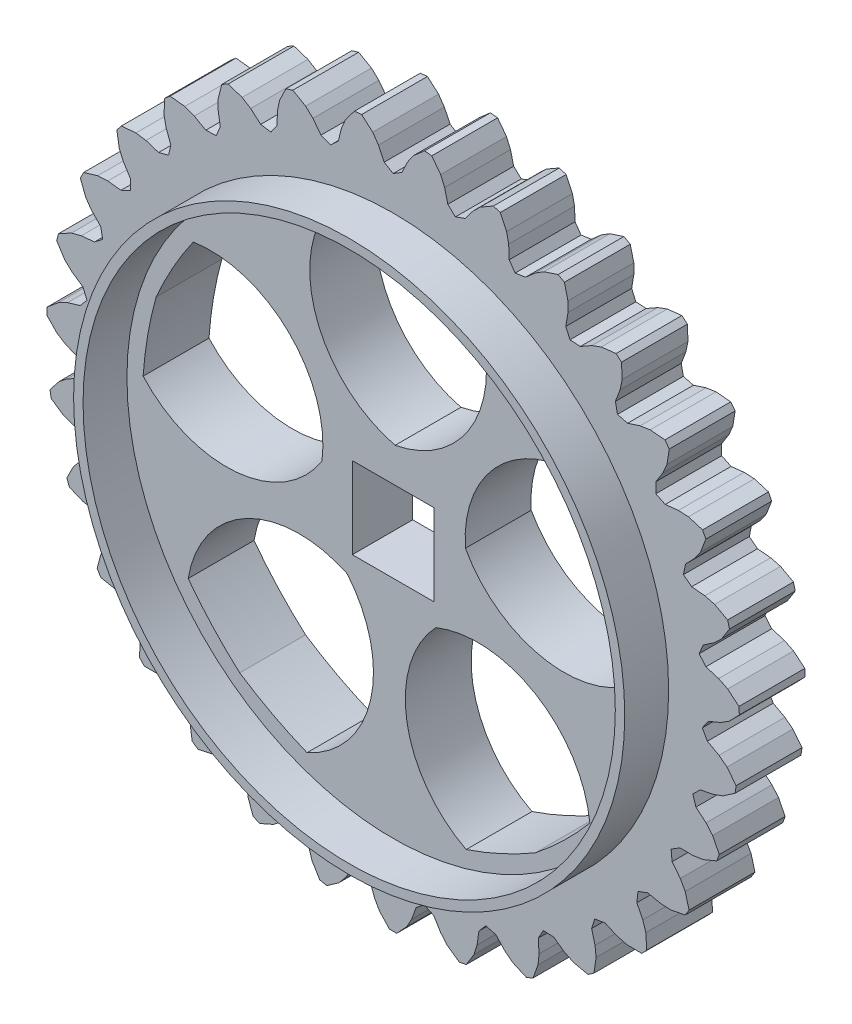
from build123d import *

# Parameters (mm, degrees)
SKETCH1_R           = 31.574
SKETCH1_W           = 7.424621202
SKETCH1_H           = 7.424621202
BOSS_EXTRUDE1_DEPTH = 6
CUT_EXTRUDE1_DEPTH  = 46.05368966
CIRPATTERN1_COUNT   = 31
CUT_EXTRUDE2_DEPTH  = 46.035781226
SKETCH5_R           = 25.109802293
SKETCH5_R_2         = 24.249619568
BOSS_EXTRUDE2_DEPTH = 10
CIRPATTERN2_COUNT   = 5
CHAMFER1_SIZE       = 0.5


with BuildPart() as part:
    # Sketch1 → Boss-Extrude1 (new body)
    with BuildSketch(Plane.XY):
        Circle(SKETCH1_R)
        Rectangle(SKETCH1_W, SKETCH1_H, mode=Mode.SUBTRACT)
    extrude(amount=BOSS_EXTRUDE1_DEPTH)

    # Sketch2 → Cut-Extrude1 (cut, through all)
    with BuildSketch(Plane.XY):
        Polygon((0, 28.213982847), (-0.806852748, 28.712342457), (-1.329964738, 29.802159103), (-1.855743872, 30.55776531), (-2.866453658, 31.443614923), (-1.855743872, 32.216146789), (0, 32.812066738), (1.855743872, 32.216146789), (2.866453658, 31.443614923), (1.855743872, 30.55776531), (1.329964738, 29.802159103), (0.806852748, 28.712342457), align=None)
    cut_extrude1 = extrude(amount=CUT_EXTRUDE1_DEPTH, mode=Mode.SUBTRACT)

    # CirPattern1: Cut-Extrude1 ×31 about axis
    cirpattern1_axis = Axis((0, 0, 6), (0, 0, -1))
    for i in range(1, CIRPATTERN1_COUNT):
        add(cut_extrude1.rotate(cirpattern1_axis, i * 360 / CIRPATTERN1_COUNT), mode=Mode.SUBTRACT)

    # Sketch4 → Cut-Extrude2 (cut, symmetric)
    with BuildSketch(Plane.XY):
        with BuildLine():
            ThreePointArc((0.187190222, 6.867541283), (-6.769169462, 12.795825389), (-6.236882725, 21.920087733))
            ThreePointArc((-6.236882725, 21.920087733), (-2.831382802, 22.589334199), (0.624450923, 22.909543239))
            ThreePointArc((0.624450923, 22.909543239), (4.057710317, 22.401556533), (7.421697179, 21.54779254))
            ThreePointArc((7.421697179, 21.54779254), (7.456158425, 12.40808221), (0.187190222, 6.867541283))
        make_face()
    cut_extrude2 = extrude(amount=CUT_EXTRUDE2_DEPTH, both=True, mode=Mode.SUBTRACT)

    # CirPattern2: Cut-Extrude2 ×5 about axis
    cirpattern2_axis = Axis((0, 0, 10), (0, 0, -1))
    for i in range(1, CIRPATTERN2_COUNT):
        add(cut_extrude2.rotate(cirpattern2_axis, i * 360 / CIRPATTERN2_COUNT), mode=Mode.SUBTRACT)

    # Chamfer1
    chamfer1_edges = [part.edges().sort_by_distance(p)[0] for p in [
        (-3.712310601, 0, 0),
        (0, -3.712310601, 0),
        (3.712310601, 0, 0),
        (0, 3.712310601, 0),
    ]]
    chamfer(chamfer1_edges, length=CHAMFER1_SIZE)


with BuildPart() as body_2:
    # Sketch5 → Boss-Extrude2 (new body)
    with BuildSketch(Plane.XY):
        Circle(SKETCH5_R)
        Circle(SKETCH5_R_2, mode=Mode.SUBTRACT)
    extrude(amount=BOSS_EXTRUDE2_DEPTH)


solid = Compound([part.part, body_2.part])
